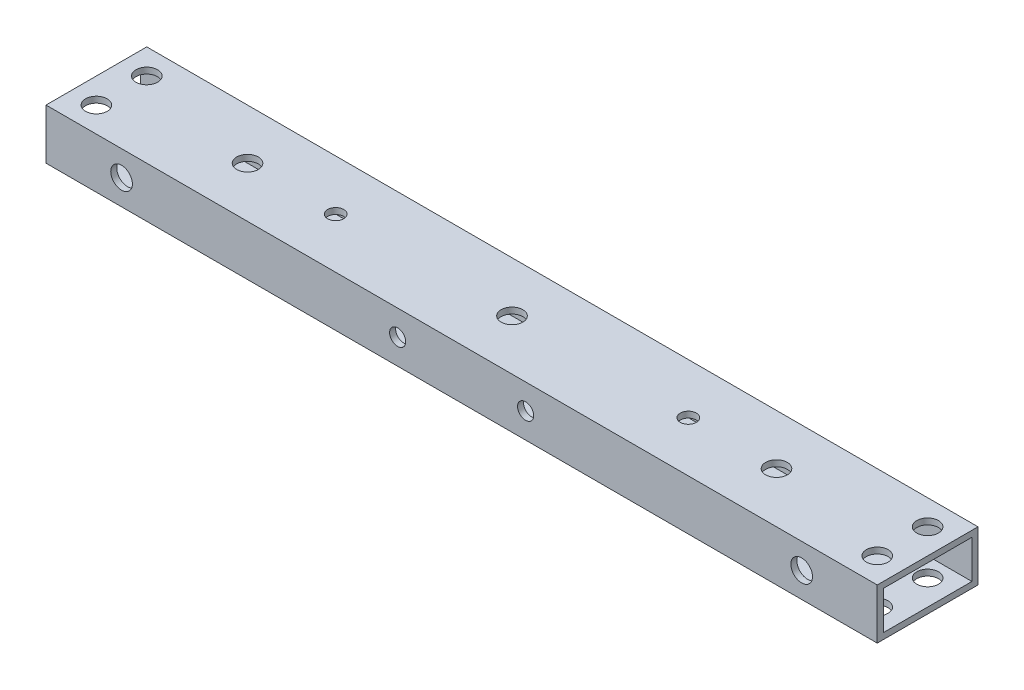
from build123d import *

# Parameters (mm, degrees)
SKETCH_1_W          = 20
SKETCH_1_H          = 10
SKETCH_1_W_2        = 17.6
SKETCH_1_H_2        = 7.6
EXTRUDE_1_DEPTH     = 165
SKETCH_2_R          = 2.15
SKETCH_2_R_2        = 1.6
CUT_EXTRUDE_1_DEPTH = 166.604951617
SKETCH_3_R          = 2.15
CUT_EXTRUDE_2_DEPTH = 167.282891483
SKETCH_4_R          = 1.6
CUT_EXTRUDE_3_DEPTH = 167.282891483


with BuildPart() as part:
    # ｽｹｯﾁ1 → 押し出し-薄板1 (new body)
    with BuildSketch(Plane(origin=(0, 0, 0), x_dir=(0, 0, -1), z_dir=(1, 0, 0))):
        Rectangle(SKETCH_1_W, SKETCH_1_H)
        Rectangle(SKETCH_1_W_2, SKETCH_1_H_2, mode=Mode.SUBTRACT)
    extrude(amount=EXTRUDE_1_DEPTH)

    # ｽｹｯﾁ2 → ｶｯﾄ - 押し出し1 (cut, through all)
    with BuildSketch(Plane(origin=(0, 5, 0), x_dir=(1, 0, 0), z_dir=(0, 1, 0))):
        with Locations((135, 0)):
            Circle(SKETCH_2_R)
        with Locations((30, 0)):
            Circle(SKETCH_2_R)
        with Locations((160, 5)):
            Circle(SKETCH_2_R)
        with Locations((160, -5)):
            Circle(SKETCH_2_R)
        with Locations((5, -5)):
            Circle(SKETCH_2_R)
        with Locations((5, 5)):
            Circle(SKETCH_2_R)
        with Locations((82.5, 0)):
            Circle(SKETCH_2_R)
        with Locations((117.5, 0)):
            Circle(SKETCH_2_R_2)
        with Locations((47.5, 0)):
            Circle(SKETCH_2_R_2)
    extrude(amount=-CUT_EXTRUDE_1_DEPTH, mode=Mode.SUBTRACT)

    # ｽｹｯﾁ3 → ｶｯﾄ - 押し出し2 (cut, through all)
    with BuildSketch(Plane.XY.offset(10)):
        with Locations((150, 0)):
            Circle(SKETCH_3_R)
        with Locations((15, 0)):
            Circle(SKETCH_3_R)
    extrude(amount=-CUT_EXTRUDE_2_DEPTH, mode=Mode.SUBTRACT)

    # ｽｹｯﾁ4 → ｶｯﾄ - 押し出し3 (cut, through all)
    with BuildSketch(Plane.XY.offset(10)):
        with Locations((95.2, 0)):
            Circle(SKETCH_4_R)
        with Locations((69.8, 0)):
            Circle(SKETCH_4_R)
    extrude(amount=-CUT_EXTRUDE_3_DEPTH, mode=Mode.SUBTRACT)


solid = part.part
